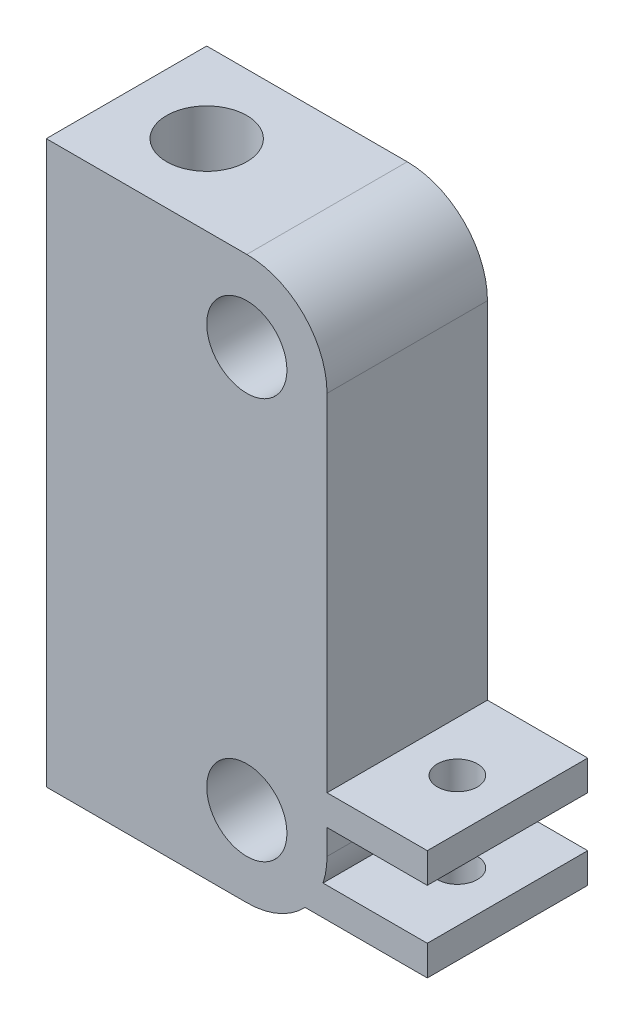
from build123d import *

# Parameters (mm, degrees)
SKETCH1_R           = 4
BOSS_EXTRUDE1_DEPTH = 16
SKETCH2_R           = 4
CUT_EXTRUDE1_DEPTH  = 63.237043653
SKETCH3_R           = 2
CUT_EXTRUDE2_DEPTH  = 51.435102881


with BuildPart() as part:
    # Sketch1 → Boss-Extrude1 (new body)
    with BuildSketch(Plane.XY):
        with BuildLine():
            Line((11.941959863, -20.868835105), (21.941959863, -20.868835105))
            Line((21.941959863, -20.868835105), (21.941959863, -23.868835105))
            Line((21.941959863, -23.868835105), (11.941959863, -23.868835105))
            Line((11.941959863, -23.868835105), (11.941959863, -26.368835105))
            ThreePointArc((11.941959863, -26.368835105), (11.841160348, -27.63478601), (11.541301939, -28.868835105))
            Line((11.541301939, -28.868835105), (21.941959863, -28.868835105))
            Line((21.941959863, -28.868835105), (21.941959863, -31.868835105))
            Line((21.941959863, -31.868835105), (9.751434882, -31.868835105))
            ThreePointArc((9.751434882, -31.868835105), (7.104237523, -33.717304334), (3.941959863, -34.368835105))
            Line((3.941959863, -34.368835105), (-16.058040137, -34.368835105))
            Line((-16.058040137, -34.368835105), (-16.058040137, 21.631164895))
            Line((-16.058040137, 21.631164895), (3.941959863, 21.631164895))
            ThreePointArc((3.941959863, 21.631164895), (9.598814112, 19.288019144), (11.941959863, 13.631164895))
            Line((11.941959863, 13.631164895), (11.941959863, -20.868835105))
        make_face()
        with Locations((3.941959863, 13.631164895)):
            Circle(SKETCH1_R, mode=Mode.SUBTRACT)
        with Locations((3.941959863, -26.368835105)):
            Circle(SKETCH1_R, mode=Mode.SUBTRACT)
    extrude(amount=-BOSS_EXTRUDE1_DEPTH)

    # Sketch2 → Cut-Extrude1 (cut, through all)
    with BuildSketch(Plane(origin=(0, 21.631164895, 0), x_dir=(1, 0, 0), z_dir=(0, 1, 0))):
        with Locations((-8.058040137, 8)):
            Circle(SKETCH2_R)
    extrude(amount=-CUT_EXTRUDE1_DEPTH, mode=Mode.SUBTRACT)

    # Sketch3 → Cut-Extrude2 (cut, through all)
    with BuildSketch(Plane(origin=(0, -20.868835105, 0), x_dir=(1, 0, 0), z_dir=(0, 1, 0))):
        with Locations((16.941959863, 8)):
            Circle(SKETCH3_R)
    extrude(amount=-CUT_EXTRUDE2_DEPTH, mode=Mode.SUBTRACT)


solid = part.part
